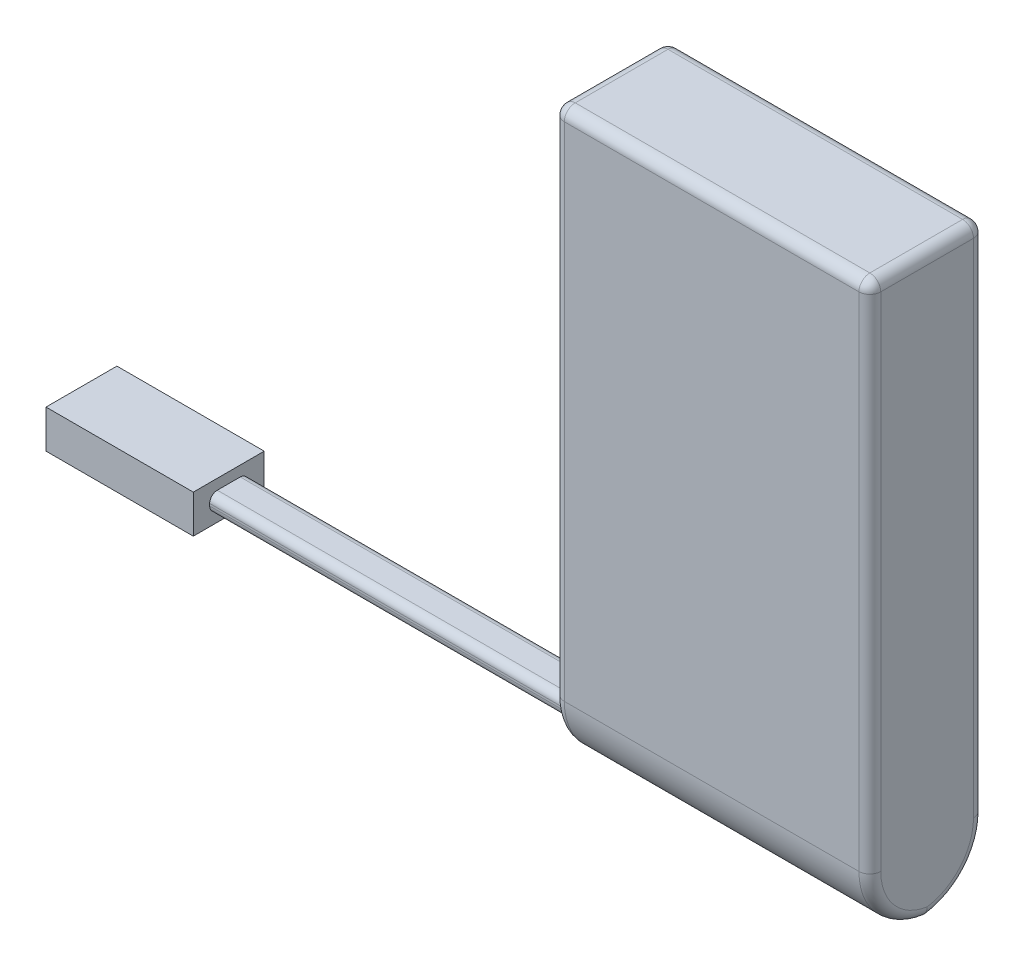
from build123d import *

# Parameters (mm, degrees)
CROQUIS1_W              = 53
CROQUIS1_H              = 29
SALIENTE_EXTRUIR1_DEPTH = 10.5
REDONDEO1_R             = 6
REDONDEO2_R             = 1
SALIENTE_EXTRUIR2_DEPTH = 35
CROQUIS3_W              = 3.5
CROQUIS3_H              = 6.5
SALIENTE_EXTRUIR3_DEPTH = 13.5


with BuildPart() as part:
    # Croquis1 → Saliente-Extruir1 (new body)
    with BuildSketch(Plane(origin=(0, 0, 0), x_dir=(0, 1, 0), z_dir=(0, 0, 1))):
        Rectangle(CROQUIS1_W, CROQUIS1_H)
    extrude(amount=SALIENTE_EXTRUIR1_DEPTH)

    # Redondeo1
    # the kernel refuses this fillet: 6 mm, written as the material it takes off along each edge
    with BuildSketch(Plane(origin=(29.5, -26.5, 0), x_dir=(0, 0, 1), z_dir=(-1, 0, 0))) as redondeo1_piece_1:
        with BuildLine():
            CenterArc((REDONDEO1_R, REDONDEO1_R), REDONDEO1_R, 180, 90)
            Line((0, REDONDEO1_R), (0, 0))
            Line((0, 0), (REDONDEO1_R, 0))
        make_face()
    extrude(amount=59, mode=Mode.SUBTRACT)
    with BuildSketch(Plane(origin=(29.5, -26.5, 10.5), x_dir=(0, 0, -1), z_dir=(-1, 0, 0))) as redondeo1_piece_2:
        with BuildLine():
            CenterArc((REDONDEO1_R, -REDONDEO1_R), REDONDEO1_R, 90, 90)
            Line((0, -REDONDEO1_R), (0, 0))
            Line((0, 0), (REDONDEO1_R, 0))
        make_face()
    extrude(amount=59, mode=Mode.SUBTRACT)

    # Redondeo2
    redondeo2_edges = [part.edges().sort_by_distance(p)[0] for p in [
        (14.5, 3, 0),
        (14.5, 3, 10.5),
        (14.5, -24.468626967, 9),
        (14.5, -24.468626967, 1.5),
        (-14.5, -24.468626967, 9),
        (-14.5, -24.468626967, 1.5),
        (0, 26.5, 10.5),
        (-14.5, 3, 0),
        (0, 26.5, 0),
        (14.5, 26.5, 5.25),
        (-14.5, 26.5, 5.25),
        (-14.5, 3, 10.5),
    ]]
    fillet(redondeo2_edges, radius=REDONDEO2_R)

    # Croquis2 → Saliente-Extruir2 (add)
    with BuildSketch(Plane(origin=(-14.5, 0, 0), x_dir=(0, -1, 0), z_dir=(-1, 0, 0))):
        with BuildLine():
            Line((24.543429983, 7), (24.743429983, 7))
            ThreePointArc((24.743429983, 7), (25.23840473, 6.794974747), (25.443429983, 6.3))
            Line((25.443429983, 6.3), (25.443429983, 4.2))
            ThreePointArc((25.443429983, 4.2), (25.23840473, 3.705025253), (24.743429983, 3.5))
            Line((24.743429983, 3.5), (24.543429983, 3.5))
            ThreePointArc((24.543429983, 3.5), (24.048455236, 3.705025253), (23.843429983, 4.2))
            Line((23.843429983, 4.2), (23.843429983, 6.3))
            ThreePointArc((23.843429983, 6.3), (24.048455236, 6.794974747), (24.543429983, 7))
        make_face()
    extrude(amount=SALIENTE_EXTRUIR2_DEPTH)

    # Croquis3 → Saliente-Extruir3 (add)
    with BuildSketch(Plane(origin=(-49.5, 0, 0), x_dir=(0, -1, 0), z_dir=(-1, 0, 0))):
        with Locations((24.643429983, 5.25)):
            Rectangle(CROQUIS3_W, CROQUIS3_H)
    extrude(amount=SALIENTE_EXTRUIR3_DEPTH)


solid = part.part
